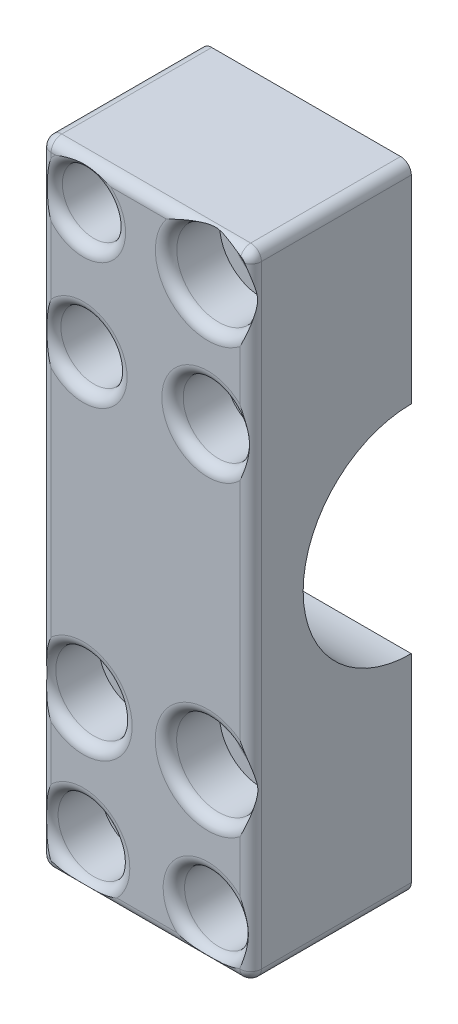
from build123d import *

# Parameters (mm, degrees)
SKETCH1_W           = 59.23
SKETCH1_H           = 19.64
SKETCH1_R           = 1.6
BOSS_EXTRUDE1_DEPTH = 15
SKETCH2_R           = 2.952572206
SKETCH2_R_2         = 3.903354956
SKETCH2_R_3         = 3.092104455
SKETCH2_R_4         = 3.299831719
SKETCH2_R_5         = 3.567608527
SKETCH2_R_6         = 3.34792304
SKETCH2_R_7         = 3.176771323
SKETCH2_R_8         = 3.915970236
CUT_EXTRUDE1_DEPTH  = 5
SKETCH6_R           = 10.1
CUT_EXTRUDE2_DEPTH  = 39.571723127
FILLET1_R           = 1


with BuildPart() as part:
    # Sketch1 → Boss-Extrude1 (new body)
    with BuildSketch(Plane(origin=(0, 0, 0), x_dir=(0, 1, 0), z_dir=(0, 0, 1))):
        Rectangle(SKETCH1_W, SKETCH1_H)
        with Locations(Location((-25.615, 5.82, 0), (0, 0, 270))):
            Circle(SKETCH1_R, mode=Mode.SUBTRACT)
        with Locations(Location((25.615, 5.82, 0), (0, 0, 270))):
            Circle(SKETCH1_R, mode=Mode.SUBTRACT)
        with Locations(Location((25.615, -5.82, 0), (0, 0, 270))):
            Circle(SKETCH1_R, mode=Mode.SUBTRACT)
        with Locations(Location((-25.615, -5.82, 0), (0, 0, 270))):
            Circle(SKETCH1_R, mode=Mode.SUBTRACT)
        with Locations(Location((-14.015, 5.82, 0), (0, 0, 270))):
            Circle(SKETCH1_R, mode=Mode.SUBTRACT)
        with Locations(Location((-14.015, -5.82, 0), (0, 0, 270))):
            Circle(SKETCH1_R, mode=Mode.SUBTRACT)
        with Locations(Location((13.975, -5.82, 0), (0, 0, 270))):
            Circle(SKETCH1_R, mode=Mode.SUBTRACT)
        with Locations(Location((13.975, 5.82, 0), (0, 0, 270))):
            Circle(SKETCH1_R, mode=Mode.SUBTRACT)
    extrude(amount=BOSS_EXTRUDE1_DEPTH)

    # Sketch2 → Cut-Extrude1 (cut)
    with BuildSketch(Plane.XY.offset(15)):
        with Locations((-5.82, 25.615)):
            Circle(SKETCH2_R)
        with Locations((5.82, 25.615)):
            Circle(SKETCH2_R_2)
        with Locations((-5.82, 13.975)):
            Circle(SKETCH2_R_3)
        with Locations((5.82, 13.975)):
            Circle(SKETCH2_R_4)
        with Locations((-5.82, -14.015)):
            Circle(SKETCH2_R_5)
        with Locations((-5.82, -25.615)):
            Circle(SKETCH2_R_6)
        with Locations((5.82, -25.615)):
            Circle(SKETCH2_R_7)
        with Locations((5.82, -14.015)):
            Circle(SKETCH2_R_8)
    extrude(amount=-CUT_EXTRUDE1_DEPTH, mode=Mode.SUBTRACT)

    # Sketch6 → Cut-Extrude2 (cut, through all)
    with BuildSketch(Plane.YZ.offset(9.82)):
        Circle(SKETCH6_R)
    extrude(amount=-CUT_EXTRUDE2_DEPTH, mode=Mode.SUBTRACT)

    # Fillet1
    # the kernel refuses this fillet: 1 mm, written as the material it takes off along each edge
    with BuildSketch(Plane(origin=(-8.82, 28.615, 14), x_dir=(0, 1, 0), z_dir=(-1, 0, 0))) as fillet1_piece_1_section:
        Polygon((0, 0), (FILLET1_R, 0), (FILLET1_R, -FILLET1_R), (0, -FILLET1_R), align=None)
    fillet1_piece_1 = extrude(amount=FILLET1_R, mode=Mode.PRIVATE)
    fillet1_piece_1 = fillet1_piece_1 - Plane(origin=(-8.82, 28.615, 14), x_dir=(0, -0.7071067811865475, -0.7071067811865475), z_dir=(-1, 0, 0)) * Sphere(FILLET1_R, mode=Mode.PRIVATE)
    add(fillet1_piece_1, mode=Mode.SUBTRACT)
    with BuildSketch(Plane(origin=(8.82, 28.615, 14), x_dir=(0, 0, 1), z_dir=(0, 1, 0))) as fillet1_piece_2_section:
        Polygon((0, 0), (FILLET1_R, 0), (FILLET1_R, FILLET1_R), (0, FILLET1_R), align=None)
    fillet1_piece_2 = extrude(amount=FILLET1_R, mode=Mode.PRIVATE)
    fillet1_piece_2 = fillet1_piece_2 - Plane(origin=(8.82, 28.615, 14), x_dir=(-0.7071067811865475, 0, -0.7071067811865475), z_dir=(0, 1, 0)) * Sphere(FILLET1_R, mode=Mode.PRIVATE)
    add(fillet1_piece_2, mode=Mode.SUBTRACT)
    with BuildSketch(Plane(origin=(-8.82, -28.615, 14), x_dir=(0, 0, 1), z_dir=(-1, 0, 0))) as fillet1_piece_3_section:
        Polygon((0, 0), (FILLET1_R, 0), (FILLET1_R, -FILLET1_R), (0, -FILLET1_R), align=None)
    fillet1_piece_3 = extrude(amount=FILLET1_R, mode=Mode.PRIVATE)
    fillet1_piece_3 = fillet1_piece_3 - Plane(origin=(-8.82, -28.615, 14), x_dir=(0, 0.7071067811865475, -0.7071067811865475), z_dir=(-1, 0, 0)) * Sphere(FILLET1_R, mode=Mode.PRIVATE)
    add(fillet1_piece_3, mode=Mode.SUBTRACT)
    with BuildSketch(Plane(origin=(8.82, -28.615, 14), x_dir=(0, -1, 0), z_dir=(0, 0, 1))) as fillet1_piece_4_section:
        Polygon((0, 0), (FILLET1_R, 0), (FILLET1_R, FILLET1_R), (0, FILLET1_R), align=None)
    fillet1_piece_4 = extrude(amount=FILLET1_R, mode=Mode.PRIVATE)
    fillet1_piece_4 = fillet1_piece_4 - Plane(origin=(8.82, -28.615, 14), x_dir=(-0.7071067811865477, 0.7071067811865475, 0), z_dir=(0, 0, 1)) * Sphere(FILLET1_R, mode=Mode.PRIVATE)
    add(fillet1_piece_4, mode=Mode.SUBTRACT)
    with BuildSketch(Plane(origin=(-8.82, 29.615, 15), x_dir=(0, 0, -1), z_dir=(1, 0, 0))) as fillet1_piece_5:
        with BuildLine():
            CenterArc((FILLET1_R, -FILLET1_R), FILLET1_R, 90, 90)
            Line((0, -FILLET1_R), (0, 0))
            Line((0, 0), (FILLET1_R, 0))
        make_face()
    extrude(amount=17.64, mode=Mode.SUBTRACT)
    with BuildSketch(Plane(origin=(-9.82, -28.615, 15), x_dir=(0, 0, -1), z_dir=(0, 1, 0))) as fillet1_piece_6:
        with BuildLine():
            CenterArc((FILLET1_R, -FILLET1_R), FILLET1_R, 90, 90)
            Line((0, -FILLET1_R), (0, 0))
            Line((0, 0), (FILLET1_R, 0))
        make_face()
    extrude(amount=57.23, mode=Mode.SUBTRACT)
    with BuildSketch(Plane(origin=(8.82, -29.615, 15), x_dir=(0, 1, 0), z_dir=(-1, 0, 0))) as fillet1_piece_7:
        with BuildLine():
            CenterArc((FILLET1_R, FILLET1_R), FILLET1_R, 180, 90)
            Line((0, FILLET1_R), (0, 0))
            Line((0, 0), (FILLET1_R, 0))
        make_face()
    extrude(amount=17.64, mode=Mode.SUBTRACT)
    with BuildSketch(Plane(origin=(-5.82, -14.015, 10), x_dir=(1, 0, 0), z_dir=(0, 1, 0))) as fillet1_piece_8:
        with BuildLine():
            CenterArc((1.6 + FILLET1_R, FILLET1_R), FILLET1_R, 180, 90)
            Line((1.6 + FILLET1_R, 0), (1.6, 0))
            Line((1.6, 0), (1.6, FILLET1_R))
        make_face()
    revolve(axis=Axis((-5.82, -14.015, 10), (0, 0, -1)), mode=Mode.SUBTRACT)
    with BuildSketch(Plane(origin=(-5.82, -14.015, 15), x_dir=(1, 0, 0), z_dir=(0, -1, 0))) as fillet1_piece_9:
        with BuildLine():
            CenterArc((3.567608527 + FILLET1_R, -FILLET1_R), FILLET1_R, 90, 90)
            Line((3.567608527, -FILLET1_R), (3.567608527, 0))
            Line((3.567608527, 0), (3.567608527 + FILLET1_R, 0))
        make_face()
    revolve(axis=Axis((-5.82, -14.015, 15), (0, 0, 1)), mode=Mode.SUBTRACT)
    with BuildSketch(Plane(origin=(5.82, 13.975, 10), x_dir=(1, 0, 0), z_dir=(0, 1, 0))) as fillet1_piece_10:
        with BuildLine():
            CenterArc((1.6 + FILLET1_R, FILLET1_R), FILLET1_R, 180, 90)
            Line((1.6 + FILLET1_R, 0), (1.6, 0))
            Line((1.6, 0), (1.6, FILLET1_R))
        make_face()
    revolve(axis=Axis((5.82, 13.975, 10), (0, 0, -1)), mode=Mode.SUBTRACT)
    with BuildSketch(Plane(origin=(5.82, 13.975, 15), x_dir=(1, 0, 0), z_dir=(0, -1, 0))) as fillet1_piece_11:
        with BuildLine():
            CenterArc((3.299831719 + FILLET1_R, -FILLET1_R), FILLET1_R, 90, 90)
            Line((3.299831719, -FILLET1_R), (3.299831719, 0))
            Line((3.299831719, 0), (3.299831719 + FILLET1_R, 0))
        make_face()
    revolve(axis=Axis((5.82, 13.975, 15), (0, 0, 1)), mode=Mode.SUBTRACT)
    with BuildSketch(Plane(origin=(-5.82, 13.975, 10), x_dir=(1, 0, 0), z_dir=(0, 1, 0))) as fillet1_piece_12:
        with BuildLine():
            CenterArc((1.6 + FILLET1_R, FILLET1_R), FILLET1_R, 180, 90)
            Line((1.6 + FILLET1_R, 0), (1.6, 0))
            Line((1.6, 0), (1.6, FILLET1_R))
        make_face()
    revolve(axis=Axis((-5.82, 13.975, 10), (0, 0, -1)), mode=Mode.SUBTRACT)
    with BuildSketch(Plane(origin=(-5.82, 13.975, 15), x_dir=(1, 0, 0), z_dir=(0, -1, 0))) as fillet1_piece_13:
        with BuildLine():
            CenterArc((3.092104455 + FILLET1_R, -FILLET1_R), FILLET1_R, 90, 90)
            Line((3.092104455, -FILLET1_R), (3.092104455, 0))
            Line((3.092104455, 0), (3.092104455 + FILLET1_R, 0))
        make_face()
    revolve(axis=Axis((-5.82, 13.975, 15), (0, 0, 1)), mode=Mode.SUBTRACT)
    with BuildSketch(Plane(origin=(5.82, 25.615, 10), x_dir=(1, 0, 0), z_dir=(0, 1, 0))) as fillet1_piece_14:
        with BuildLine():
            CenterArc((1.6 + FILLET1_R, FILLET1_R), FILLET1_R, 180, 90)
            Line((1.6 + FILLET1_R, 0), (1.6, 0))
            Line((1.6, 0), (1.6, FILLET1_R))
        make_face()
    revolve(axis=Axis((5.82, 25.615, 10), (0, 0, -1)), mode=Mode.SUBTRACT)
    with BuildSketch(Plane(origin=(5.82, 25.615, 15), x_dir=(1, 0, 0), z_dir=(0, -1, 0))) as fillet1_piece_15:
        with BuildLine():
            CenterArc((3.903354956 + FILLET1_R, -FILLET1_R), FILLET1_R, 90, 90)
            Line((3.903354956, -FILLET1_R), (3.903354956, 0))
            Line((3.903354956, 0), (3.903354956 + FILLET1_R, 0))
        make_face()
    revolve(axis=Axis((5.82, 25.615, 15), (0, 0, 1)), mode=Mode.SUBTRACT)
    with BuildSketch(Plane(origin=(-5.82, -25.615, 10), x_dir=(1, 0, 0), z_dir=(0, 1, 0))) as fillet1_piece_16:
        with BuildLine():
            CenterArc((1.6 + FILLET1_R, FILLET1_R), FILLET1_R, 180, 90)
            Line((1.6 + FILLET1_R, 0), (1.6, 0))
            Line((1.6, 0), (1.6, FILLET1_R))
        make_face()
    revolve(axis=Axis((-5.82, -25.615, 10), (0, 0, -1)), mode=Mode.SUBTRACT)
    with BuildSketch(Plane(origin=(-5.82, -25.615, 15), x_dir=(1, 0, 0), z_dir=(0, -1, 0))) as fillet1_piece_17:
        with BuildLine():
            CenterArc((3.34792304 + FILLET1_R, -FILLET1_R), FILLET1_R, 90, 90)
            Line((3.34792304, -FILLET1_R), (3.34792304, 0))
            Line((3.34792304, 0), (3.34792304 + FILLET1_R, 0))
        make_face()
    revolve(axis=Axis((-5.82, -25.615, 15), (0, 0, 1)), mode=Mode.SUBTRACT)
    with BuildSketch(Plane(origin=(5.82, -25.615, 10), x_dir=(1, 0, 0), z_dir=(0, 1, 0))) as fillet1_piece_18:
        with BuildLine():
            CenterArc((1.6 + FILLET1_R, FILLET1_R), FILLET1_R, 180, 90)
            Line((1.6 + FILLET1_R, 0), (1.6, 0))
            Line((1.6, 0), (1.6, FILLET1_R))
        make_face()
    revolve(axis=Axis((5.82, -25.615, 10), (0, 0, -1)), mode=Mode.SUBTRACT)
    with BuildSketch(Plane(origin=(5.82, -25.615, 15), x_dir=(1, 0, 0), z_dir=(0, -1, 0))) as fillet1_piece_19:
        with BuildLine():
            CenterArc((3.176771323 + FILLET1_R, -FILLET1_R), FILLET1_R, 90, 90)
            Line((3.176771323, -FILLET1_R), (3.176771323, 0))
            Line((3.176771323, 0), (3.176771323 + FILLET1_R, 0))
        make_face()
    revolve(axis=Axis((5.82, -25.615, 15), (0, 0, 1)), mode=Mode.SUBTRACT)
    with BuildSketch(Plane(origin=(5.82, -14.015, 10), x_dir=(1, 0, 0), z_dir=(0, 1, 0))) as fillet1_piece_20:
        with BuildLine():
            CenterArc((1.6 + FILLET1_R, FILLET1_R), FILLET1_R, 180, 90)
            Line((1.6 + FILLET1_R, 0), (1.6, 0))
            Line((1.6, 0), (1.6, FILLET1_R))
        make_face()
    revolve(axis=Axis((5.82, -14.015, 10), (0, 0, -1)), mode=Mode.SUBTRACT)
    with BuildSketch(Plane(origin=(5.82, -14.015, 15), x_dir=(1, 0, 0), z_dir=(0, -1, 0))) as fillet1_piece_21:
        with BuildLine():
            CenterArc((3.915970236 + FILLET1_R, -FILLET1_R), FILLET1_R, 90, 90)
            Line((3.915970236, -FILLET1_R), (3.915970236, 0))
            Line((3.915970236, 0), (3.915970236 + FILLET1_R, 0))
        make_face()
    revolve(axis=Axis((5.82, -14.015, 15), (0, 0, 1)), mode=Mode.SUBTRACT)
    with BuildSketch(Plane(origin=(-9.82, -29.615, -2.5), x_dir=(0, 1, 0), z_dir=(0, 0, 1)), Plane(origin=(9.82, -29.615, -2.5), x_dir=(-1, 0, 0), z_dir=(0, 0, 1))) as fillet1_piece_22:
        with BuildLine():
            CenterArc((FILLET1_R, -FILLET1_R), FILLET1_R, 90, 90)
            Line((0, -FILLET1_R), (0, 0))
            Line((0, 0), (FILLET1_R, 0))
        make_face()
    extrude(amount=16.5, mode=Mode.SUBTRACT)
    with BuildSketch(Plane(origin=(-9.82, 29.615, -2.5), x_dir=(0, -1, 0), z_dir=(0, 0, 1)), Plane(origin=(9.82, 29.615, -2.5), x_dir=(-1, 0, 0), z_dir=(0, 0, 1))) as fillet1_piece_23:
        with BuildLine():
            CenterArc((FILLET1_R, FILLET1_R), FILLET1_R, 180, 90)
            Line((0, FILLET1_R), (0, 0))
            Line((0, 0), (FILLET1_R, 0))
        make_face()
    extrude(amount=16.5, mode=Mode.SUBTRACT)
    with BuildSketch(Plane(origin=(-5.82, 25.615, 10), x_dir=(1, 0, 0), z_dir=(0, 1, 0))) as fillet1_piece_24:
        with BuildLine():
            CenterArc((1.6 + FILLET1_R, FILLET1_R), FILLET1_R, 180, 90)
            Line((1.6 + FILLET1_R, 0), (1.6, 0))
            Line((1.6, 0), (1.6, FILLET1_R))
        make_face()
    revolve(axis=Axis((-5.82, 25.615, 10), (0, 0, -1)), mode=Mode.SUBTRACT)
    with BuildSketch(Plane(origin=(-5.82, 25.615, 15), x_dir=(1, 0, 0), z_dir=(0, -1, 0))) as fillet1_piece_25:
        with BuildLine():
            CenterArc((2.952572206 + FILLET1_R, -FILLET1_R), FILLET1_R, 90, 90)
            Line((2.952572206, -FILLET1_R), (2.952572206, 0))
            Line((2.952572206, 0), (2.952572206 + FILLET1_R, 0))
        make_face()
    revolve(axis=Axis((-5.82, 25.615, 15), (0, 0, 1)), mode=Mode.SUBTRACT)
    with BuildSketch(Plane(origin=(9.82, 28.615, 15), x_dir=(-1, 0, 0), z_dir=(0, -1, 0))) as fillet1_piece_26:
        with BuildLine():
            CenterArc((FILLET1_R, FILLET1_R), FILLET1_R, 180, 90)
            Line((0, FILLET1_R), (0, 0))
            Line((0, 0), (FILLET1_R, 0))
        make_face()
    extrude(amount=57.23, mode=Mode.SUBTRACT)


solid = part.part
